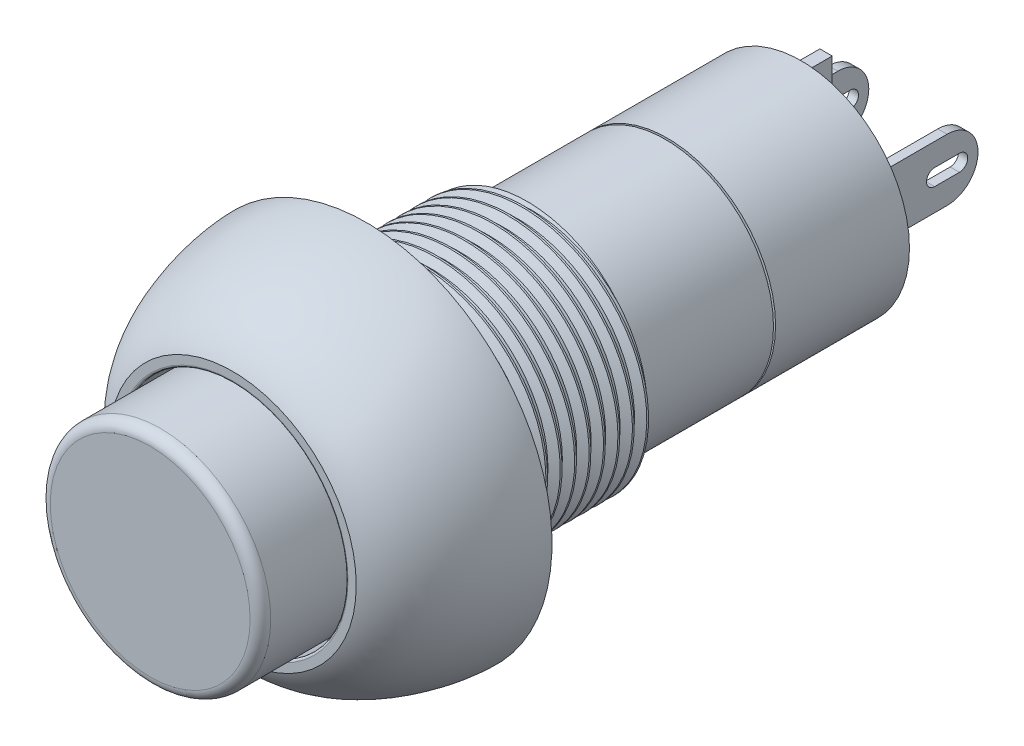
from build123d import *

# Parameters (mm, degrees)
SKETCH_1_R          = 6
EXTRUDE_1_DEPTH     = 8
SKETCH_2_R          = 5.25
EXTRUDE_2_DEPTH     = 6.5
THREAD_1_PITCH      = 0.7
SKETCH_8_R          = 5.1
EXTRUDE_3_DEPTH     = 0.1
SKETCH_9_R          = 5.25
EXTRUDE_4_DEPTH     = 6.5
SKETCH_10_R         = 5
CUT_EXTRUDE_1_DEPTH = 0.3
SKETCH_11_W         = 0.6
SKETCH_11_H         = 10
EXTRUDE_5_DEPTH     = 1.5
CUT_EXTRUDE_2_DEPTH = 4
SKETCH_13_W         = 0.45
SKETCH_13_H         = 4.95
EXTRUDE_6_DEPTH     = 4.5
SKETCH_14_W         = 0.45
SKETCH_14_H         = 3
EXTRUDE_7_DEPTH     = 5.5
CUT_EXTRUDE_3_DEPTH = 7.5
SKETCH_17_R         = 5.5
CUT_EXTRUDE_4_DEPTH = 5.5
SKETCH_19_R         = 5.35
EXTRUDE_8_DEPTH     = 9.5
FILLET_1_R          = 0.5
FILLET_2_R          = 0.1


with BuildPart() as part:
    # Sketch 1 → Бобышка-Вытянуть1 (new body)
    with BuildSketch(Plane.XY):
        Circle(SKETCH_1_R)
    extrude(amount=EXTRUDE_1_DEPTH)

    # Эскиз2 → Бобышка-Вытянуть2 (add)
    with BuildSketch(Plane(origin=(0, 0, 0), x_dir=(-1, 0, 0), z_dir=(0, 0, -1))):
        with Locations(Location((0, 0, 0), (0, 0, 180))):
            Circle(SKETCH_2_R)
    extrude(amount=EXTRUDE_2_DEPTH)

    # Резьба1: the profile of Sketch 1 2 profile screwed along a right-hand helix of 14.285714 turns, 6 arcs to a turn; built about Z, then put on its axis
    thread_1_z = Axis((0, 0, 0), (0, 0, 1))
    thread_1_corners = [(6.0003, 0, -0.000173205), (6.0003, 0, 0.612673203), (5.621113888, 0, 0.393749999), (5.621113888, 0, 0.218749999)]
    with BuildLine(mode=Mode.PRIVATE) as thread_1_profile:
        Line(thread_1_corners[0], thread_1_corners[1])
        Line(thread_1_corners[1], thread_1_corners[2])
        Line(thread_1_corners[2], thread_1_corners[3])
        Line(thread_1_corners[3], thread_1_corners[0])
    thread_1_cap = Face(thread_1_profile.wire())
    thread_1_turn_angles = [0, 30, 60, 90, 120, 150, 180, 210, 240, 270, 300, 330, 360]
    thread_1_turn_weights = [1, 0.8660254037844387, 1, 0.8660254037844387, 1, 0.8660254037844387, 1, 0.8660254037844387, 1, 0.8660254037844387, 1, 0.8660254037844387, 1]
    thread_1_turn_rails = [Edge.make_bspline([Vector(p[0], p[1], 0).rotate(thread_1_z, thread_1_turn_angles[k]) / thread_1_turn_weights[k] + Vector(0, 0, p[2] + THREAD_1_PITCH * thread_1_turn_angles[k] / 360) for k in range(13)], [0, 0, 0, 1, 1, 2, 2, 3, 3, 4, 4, 5, 5, 6, 6, 6], 2, thread_1_turn_weights) for p in thread_1_corners]
    thread_1_turn_sides = [Face.make_surface_from_curves(thread_1_turn_rails[p[0]], thread_1_turn_rails[p[1]]) for p in [(0, 1), (1, 2), (2, 3), (3, 0)]]
    thread_1_last_angles = [5040, 5070, 5100, 5121.428571429, 5142.857142857]
    thread_1_last_weights = [1, 0.8660254037844387, 1, 0.9308737486442035, 1]
    thread_1_last_rails = [Edge.make_bspline([Vector(p[0], p[1], 0).rotate(thread_1_z, thread_1_last_angles[k]) / thread_1_last_weights[k] + Vector(0, 0, p[2] + THREAD_1_PITCH * thread_1_last_angles[k] / 360) for k in range(5)], [0, 0, 0, 1, 1, 2, 2, 2], 2, thread_1_last_weights) for p in thread_1_corners]
    thread_1_last_sides = [Face.make_surface_from_curves(thread_1_last_rails[p[0]], thread_1_last_rails[p[1]]) for p in [(0, 1), (1, 2), (2, 3), (3, 0)]]
    thread_1 = Plane(origin=(0, 0, -1), x_dir=(1, 0, 0), z_dir=(0, 0, 1)) * Solid(Shell([*[p.moved(Location((0, 0, THREAD_1_PITCH * i))) for i in range(14) for p in thread_1_turn_sides], *thread_1_last_sides, thread_1_cap, thread_1_cap.rotate(thread_1_z, 5142.857142857).moved(Location((0, 0, THREAD_1_PITCH * 5142.857142857 / 360)))]))
    add(thread_1, mode=Mode.SUBTRACT)

    # Эскиз8 → Бобышка-Вытянуть3 (add)
    with BuildSketch(Plane(origin=(0, 0, -6.5), x_dir=(-1, 0, 0), z_dir=(0, 0, -1))):
        Circle(SKETCH_8_R)
    extrude(amount=EXTRUDE_3_DEPTH)

    # Эскиз9 → Бобышка-Вытянуть4 (add)
    with BuildSketch(Plane(origin=(0, 0, -6.6), x_dir=(-1, 0, 0), z_dir=(0, 0, -1))):
        with Locations(Location((0, 0, 0), (0, 0, 180))):
            Circle(SKETCH_9_R)
    extrude(amount=EXTRUDE_4_DEPTH)

    # Эскиз10 → Вырез-Вытянуть1 (cut)
    with BuildSketch(Plane(origin=(0, 0, -13.1), x_dir=(-1, 0, 0), z_dir=(0, 0, -1))):
        Circle(SKETCH_10_R)
    extrude(amount=-CUT_EXTRUDE_1_DEPTH, mode=Mode.SUBTRACT)

    # Эскиз11 → Бобышка-Вытянуть5 (add)
    with BuildSketch(Plane(origin=(0, 0, -12.8), x_dir=(-1, 0, 0), z_dir=(0, 0, -1))):
        Rectangle(SKETCH_11_W, SKETCH_11_H)
    extrude(amount=EXTRUDE_5_DEPTH)

    # Эскиз12 → Вырез-Вытянуть2 (cut)
    with BuildSketch(Plane(origin=(0, 0, -12.8), x_dir=(-1, 0, 0), z_dir=(0, 0, -1))):
        with BuildLine():
            Line((-2.9, -2.5), (-2.4, -2.5))
            Line((-2.4, -2.5), (-2.4, -0.433012702))
            ThreePointArc((-2.4, -0.433012702), (-2.15, 0), (-2.4, 0.433012702))
            Line((-2.4, 0.433012702), (-2.4, 2.5))
            Line((-2.4, 2.5), (-2.9, 2.5))
            Line((-2.9, 2.5), (-2.9, 0.433012702))
            ThreePointArc((-2.9, 0.433012702), (-3.15, 0), (-2.9, -0.433012702))
            Line((-2.9, -0.433012702), (-2.9, -2.5))
        make_face()
        with BuildLine():
            Line((2.9, 0.433012702), (2.9, 2.5))
            Line((2.9, 2.5), (2.4, 2.5))
            Line((2.4, 2.5), (2.4, 0.433012702))
            ThreePointArc((2.4, 0.433012702), (2.15, 0), (2.4, -0.433012702))
            Line((2.4, -0.433012702), (2.4, -2.5))
            Line((2.4, -2.5), (2.9, -2.5))
            Line((2.9, -2.5), (2.9, -0.433012702))
            ThreePointArc((2.9, -0.433012702), (3.15, 0), (2.9, 0.433012702))
        make_face()
    extrude(amount=-CUT_EXTRUDE_2_DEPTH, mode=Mode.SUBTRACT)

    # Эскиз13 → Бобышка-Вытянуть6 (add)
    with BuildSketch(Plane(origin=(0, 0, -8.8), x_dir=(-1, 0, 0), z_dir=(0, 0, -1))):
        with Locations((-2.65, 0)):
            Rectangle(SKETCH_13_W, SKETCH_13_H)
        with Locations((2.65, 0)):
            Rectangle(SKETCH_13_W, SKETCH_13_H)
    extrude(amount=EXTRUDE_6_DEPTH)

    # Эскиз14 → Бобышка-Вытянуть7 (add)
    with BuildSketch(Plane(origin=(0, 0, -13.3), x_dir=(-1, 0, 0), z_dir=(0, 0, -1))):
        with Locations((-2.65, 0)):
            Rectangle(SKETCH_14_W, SKETCH_14_H)
        with Locations((2.65, 0)):
            Rectangle(SKETCH_14_W, SKETCH_14_H)
    extrude(amount=EXTRUDE_7_DEPTH)

    # Эскиз15 → Вырез-Вытянуть3 (cut)
    with BuildSketch(Plane(origin=(2.875, 0, 0), x_dir=(0, 0, -1), z_dir=(1, 0, 0))):
        with BuildLine():
            Line((17.3, 1.5), (17.3, 1.871132662))
            Line((17.3, 1.871132662), (19.899476877, 1.871132662))
            Line((19.899476877, 1.871132662), (19.899476877, -2.28518044))
            Line((19.899476877, -2.28518044), (17.3, -2.28518044))
            Line((17.3, -2.28518044), (17.3, -1.5))
            ThreePointArc((17.3, -1.5), (18.8, 0), (17.3, 1.5))
        make_face()
        with BuildLine():
            Line((16.7, 0.4), (17.9, 0.4))
            ThreePointArc((17.9, 0.4), (18.3, 0), (17.9, -0.4))
            Line((17.9, -0.4), (16.7, -0.4))
            ThreePointArc((16.7, -0.4), (16.3, 0), (16.7, 0.4))
        make_face()
    extrude(amount=-CUT_EXTRUDE_3_DEPTH, mode=Mode.SUBTRACT)

    # Эскиз16 → Повернуть1 (revolve)
    with BuildSketch(Plane(origin=(0, 0, 0), x_dir=(0, 0, -1), z_dir=(1, 0, 0))):
        with BuildLine():
            Line((-8, 0), (-14.5, 0))
            Line((-14.5, 0), (-14.5, 6))
            add(Edge.make_bspline(
                [(-14.5, 6), (-13.478855666, 8.097718675), (-9.864116806, 9), (-8, 9)],
                knots=[0, 0, 0, 0, 1, 1, 1, 1], degree=3))
            Line((-8, 9), (-8, 0))
        make_face()
    revolve(axis=Axis((0, 0, 0), (0, 0, 1)))

    # Эскиз17 → Вырез-Вытянуть4 (cut)
    with BuildSketch(Plane.XY.offset(14.5)):
        Circle(SKETCH_17_R)
    extrude(amount=-CUT_EXTRUDE_4_DEPTH, mode=Mode.SUBTRACT)

    # Эскиз19 → Бобышка-Вытянуть8 (add)
    with BuildSketch(Plane.XY.offset(9)):
        Circle(SKETCH_19_R)
    extrude(amount=EXTRUDE_8_DEPTH)

    # Скругление1
    fillet_1_edges = [part.edges().sort_by_distance(p)[0] for p in [
        (-5.35, 0, 18.5),
    ]]
    fillet(fillet_1_edges, radius=FILLET_1_R)

    # Скругление2
    fillet_2_edges = [part.edges().sort_by_distance(p)[0] for p in [
        (-5.5, 0, 14.5),
    ]]
    fillet(fillet_2_edges, radius=FILLET_2_R)


solid = part.part
